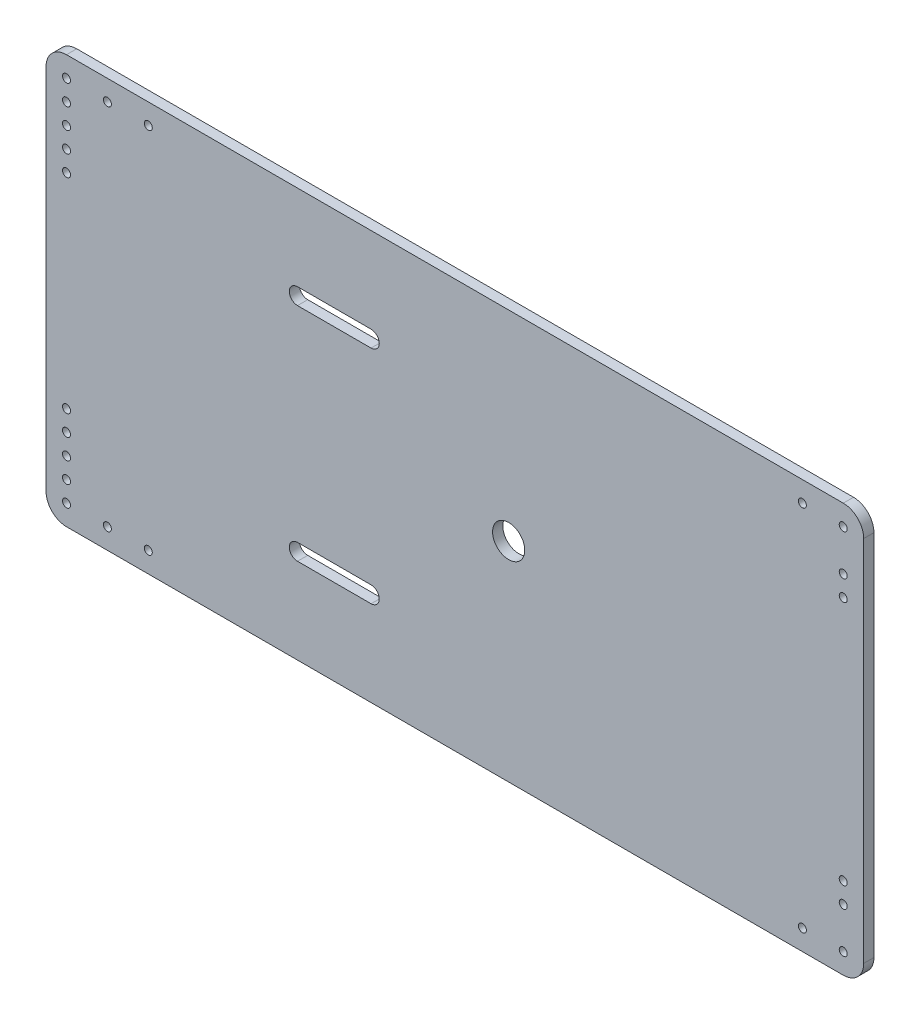
from build123d import *

# Parameters (mm, degrees)
BOSS_EXTRUDE1_DEPTH = 6.35
SKETCH2_R           = 2.5
SKETCH2_R_2         = 2.4892
CUT_EXTRUDE1_DEPTH  = 568.996762755
SKETCH3_R           = 2.4892
CUT_EXTRUDE2_DEPTH  = 568.996762755
CUT_EXTRUDE3_DEPTH  = 568.996762755
SKETCH5_R           = 10
CUT_EXTRUDE4_DEPTH  = 568.996762755


with BuildPart() as part:
    # Sketch1 → Boss-Extrude1 (new body)
    with BuildSketch(Plane.XY):
        with BuildLine():
            Line((12.7, 0), (495.3, 0))
            ThreePointArc((495.3, 0), (504.280256121, 3.719743879), (508, 12.7))
            Line((508, 12.7), (508, 241.3))
            ThreePointArc((508, 241.3), (504.280256121, 250.280256121), (495.3, 254))
            Line((495.3, 254), (12.7, 254))
            ThreePointArc((12.7, 254), (3.719743879, 250.280256121), (0, 241.3))
            Line((0, 241.3), (0, 12.7))
            ThreePointArc((0, 12.7), (3.719743879, 3.719743879), (12.7, 0))
        make_face()
    extrude(amount=BOSS_EXTRUDE1_DEPTH)

    # Sketch2 → Cut-Extrude1 (cut, through all)
    with BuildSketch(Plane.XY.offset(6.35)):
        with Locations((12.7, 190.5)):
            Circle(SKETCH2_R)
        with Locations((12.7, 203.2)):
            Circle(SKETCH2_R)
        with Locations((12.7, 215.9)):
            Circle(SKETCH2_R)
        with Locations((12.7, 228.6)):
            Circle(SKETCH2_R)
        with Locations((12.7, 241.3)):
            Circle(SKETCH2_R_2)
        with Locations((38.1, 241.3)):
            Circle(SKETCH2_R_2)
        with Locations((63.5, 241.3)):
            Circle(SKETCH2_R_2)
        with Locations((63.5, 12.7)):
            Circle(SKETCH2_R_2)
        with Locations((38.1, 12.7)):
            Circle(SKETCH2_R_2)
        with Locations((12.7, 63.5)):
            Circle(SKETCH2_R)
        with Locations((12.7, 50.8)):
            Circle(SKETCH2_R)
        with Locations((12.7, 38.1)):
            Circle(SKETCH2_R)
        with Locations((12.7, 25.4)):
            Circle(SKETCH2_R)
        with Locations((12.7, 12.7)):
            Circle(SKETCH2_R_2)
    extrude(amount=-CUT_EXTRUDE1_DEPTH, mode=Mode.SUBTRACT)

    # Sketch3 → Cut-Extrude2 (cut, through all)
    with BuildSketch(Plane.XY.offset(6.35)):
        with Locations((469.879454624, 241.3)):
            Circle(SKETCH3_R)
        with Locations((495.279454624, 241.3)):
            Circle(SKETCH3_R)
        with Locations((495.279454624, 215.9)):
            Circle(SKETCH3_R)
        with Locations((495.279454624, 203.2)):
            Circle(SKETCH3_R)
        with Locations((469.879454624, 12.7)):
            Circle(SKETCH3_R)
        with Locations((495.279454624, 12.7)):
            Circle(SKETCH3_R)
        with Locations((495.279454624, 38.1)):
            Circle(SKETCH3_R)
        with Locations((495.279454624, 50.8)):
            Circle(SKETCH3_R)
    extrude(amount=-CUT_EXTRUDE2_DEPTH, mode=Mode.SUBTRACT)

    # Sketch4 → Cut-Extrude3 (cut, through all)
    with BuildSketch(Plane.XY.offset(6.35)):
        with BuildLine():
            Line((156.21, 200.914), (201.93, 200.914))
            ThreePointArc((201.93, 200.914), (207.01, 195.834), (201.93, 190.754))
            Line((201.93, 190.754), (156.21, 190.754))
            ThreePointArc((156.21, 190.754), (151.13, 195.834), (156.21, 200.914))
        make_face()
        with BuildLine():
            Line((156.21, 63.354), (201.93, 63.354))
            ThreePointArc((201.93, 63.354), (207.01, 58.274), (201.93, 53.194))
            Line((201.93, 53.194), (156.21, 53.194))
            ThreePointArc((156.21, 53.194), (151.13, 58.274), (156.21, 63.354))
        make_face()
    extrude(amount=-CUT_EXTRUDE3_DEPTH, mode=Mode.SUBTRACT)

    # Sketch5 → Cut-Extrude4 (cut, through all)
    with BuildSketch(Plane.XY.offset(6.35)):
        with Locations((287.406455552, 129.657331692)):
            Circle(SKETCH5_R)
    extrude(amount=-CUT_EXTRUDE4_DEPTH, mode=Mode.SUBTRACT)


solid = part.part
